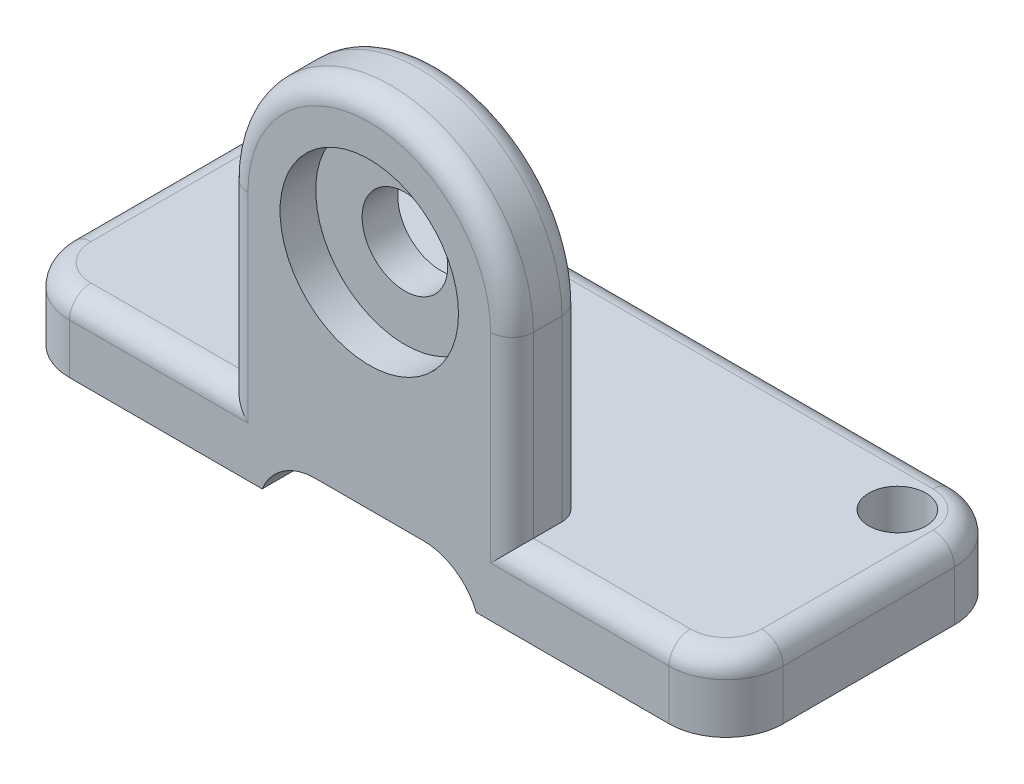
from build123d import *

# Parameters (mm, degrees)
SKETCH_1_W          = 100
SKETCH_1_H          = 40
EXTRUDE_1_DEPTH     = 10
EXTRUDE_2_DEPTH     = 10
SKETCH_3_R          = 12.5
CUT_EXTRUDE_1_DEPTH = 5
SKETCH_7_R          = 6
CUT_EXTRUDE_2_DEPTH = 5
SKETCH_10_W         = 30
SKETCH_10_H         = 5
CUT_EXTRUDE_3_DEPTH = 85.409715081
SKETCH_14_R         = 4
CUT_EXTRUDE_4_DEPTH = 71.178344238
FILLET_2_R          = 8
FILLET_3_R          = 3


with BuildPart() as part:
    # Эскиз1 → Бобышка-Вытянуть1 (new body)
    with BuildSketch(Plane(origin=(0, 0, 0), x_dir=(1, 0, 0), z_dir=(0, 1, 0))):
        Rectangle(SKETCH_1_W, SKETCH_1_H)
    extrude(amount=EXTRUDE_1_DEPTH)

    # Эскиз2 → Бобышка-Вытянуть2 (add)
    with BuildSketch(Plane.XY.offset(20)):
        with BuildLine():
            Line((-20, 0), (-20, 35))
            ThreePointArc((-20, 35), (0, 55), (20, 35))
            Line((20, 35), (20, 0))
            Line((20, 0), (-20, 0))
        make_face()
    extrude(amount=-EXTRUDE_2_DEPTH)

    # Эскиз3 → Вырез-Вытянуть1 (cut)
    with BuildSketch(Plane.XY.offset(20)):
        with Locations((0, 35)):
            Circle(SKETCH_3_R)
    extrude(amount=-CUT_EXTRUDE_1_DEPTH, mode=Mode.SUBTRACT)

    # Эскиз7 → Вырез-Вытянуть2 (cut)
    with BuildSketch(Plane.XY.offset(15)):
        with Locations((0, 35)):
            Circle(SKETCH_7_R)
    extrude(amount=-CUT_EXTRUDE_2_DEPTH, mode=Mode.SUBTRACT)

    # Эскиз10 → Вырез-Вытянуть3 (cut, through all)
    with BuildSketch(Plane.XY.offset(20)):
        with Locations((0, 2.5)):
            Rectangle(SKETCH_10_W, SKETCH_10_H)
    extrude(amount=-CUT_EXTRUDE_3_DEPTH, mode=Mode.SUBTRACT)

    # Эскиз14 → Вырез-Вытянуть4 (cut, through all)
    with BuildSketch(Plane(origin=(0, 10, 0), x_dir=(1, 0, 0), z_dir=(0, 1, 0))):
        with Locations(Location((-42, 12, 0), (0, 0, 270))):
            Circle(SKETCH_14_R)
        with Locations(Location((42, 12, 0), (0, 0, 270))):
            Circle(SKETCH_14_R)
    extrude(amount=-CUT_EXTRUDE_4_DEPTH, mode=Mode.SUBTRACT)

    # Скругление2
    # the kernel refuses this fillet: 8 mm, written as the material it adds along each edge
    with BuildSketch(Plane(origin=(-15, 5, 20), x_dir=(0, -1, 0), z_dir=(0, 0, -1))) as fillet_2_piece_1:
        with BuildLine():
            CenterArc((8, -7.416198487), FILLET_2_R, 112.024312837, 67.975687163)
            Line((0, -7.416198487), (0, 0))
            Line((0, 0), (5, 0))
        make_face()
    extrude(amount=40)
    with BuildSketch(Plane(origin=(15, 5, 20), x_dir=(-1, 0, 0), z_dir=(0, 0, -1))) as fillet_2_piece_2:
        with BuildLine():
            CenterArc((7.416198487, -8), FILLET_2_R, 90, 67.975687163)
            Line((0, -5), (0, 0))
            Line((0, 0), (7.416198487, 0))
        make_face()
    extrude(amount=40)
    # the kernel refuses this fillet: 8 mm, written as the material it takes off along each edge
    with BuildSketch(Plane(origin=(50, -20, 20), x_dir=(-1, 0, 0), z_dir=(0, 1, 0)), Plane(origin=(50, -20, -20), x_dir=(0, 0, 1), z_dir=(0, 1, 0))) as fillet_2_2_piece_1:
        with BuildLine():
            CenterArc((FILLET_2_R, -FILLET_2_R), FILLET_2_R, 90, 90)
            Line((0, -FILLET_2_R), (0, 0))
            Line((0, 0), (FILLET_2_R, 0))
        make_face()
    extrude(amount=50, mode=Mode.SUBTRACT)
    with BuildSketch(Plane(origin=(-50, -20, 20), x_dir=(1, 0, 0), z_dir=(0, 1, 0)), Plane(origin=(-50, -20, -20), x_dir=(0, 0, 1), z_dir=(0, 1, 0))) as fillet_2_2_piece_2:
        with BuildLine():
            CenterArc((FILLET_2_R, FILLET_2_R), FILLET_2_R, 180, 90)
            Line((0, FILLET_2_R), (0, 0))
            Line((0, 0), (FILLET_2_R, 0))
        make_face()
    extrude(amount=50, mode=Mode.SUBTRACT)

    # Скругление3
    fillet_3_edges = [part.edges().sort_by_distance(p)[0] for p in [
        (31, 10, 20),
        (-20, 22.5, 20),
        (20, 22.5, 10),
        (-20, 22.5, 10),
        (0, 55, 10),
        (20, 22.5, 20),
        (0, 55, 20),
        (50, 10, 0),
        (-31, 10, 20),
        (0, 10, -20),
        (-50, 10, 0),
        (47.656854249, 10, -17.656854249),
        (-47.656854249, 10, -17.656854249),
        (-47.656854249, 10, 17.656854249),
        (47.656854249, 10, 17.656854249),
    ]]
    fillet(fillet_3_edges, radius=FILLET_3_R)


solid = part.part
